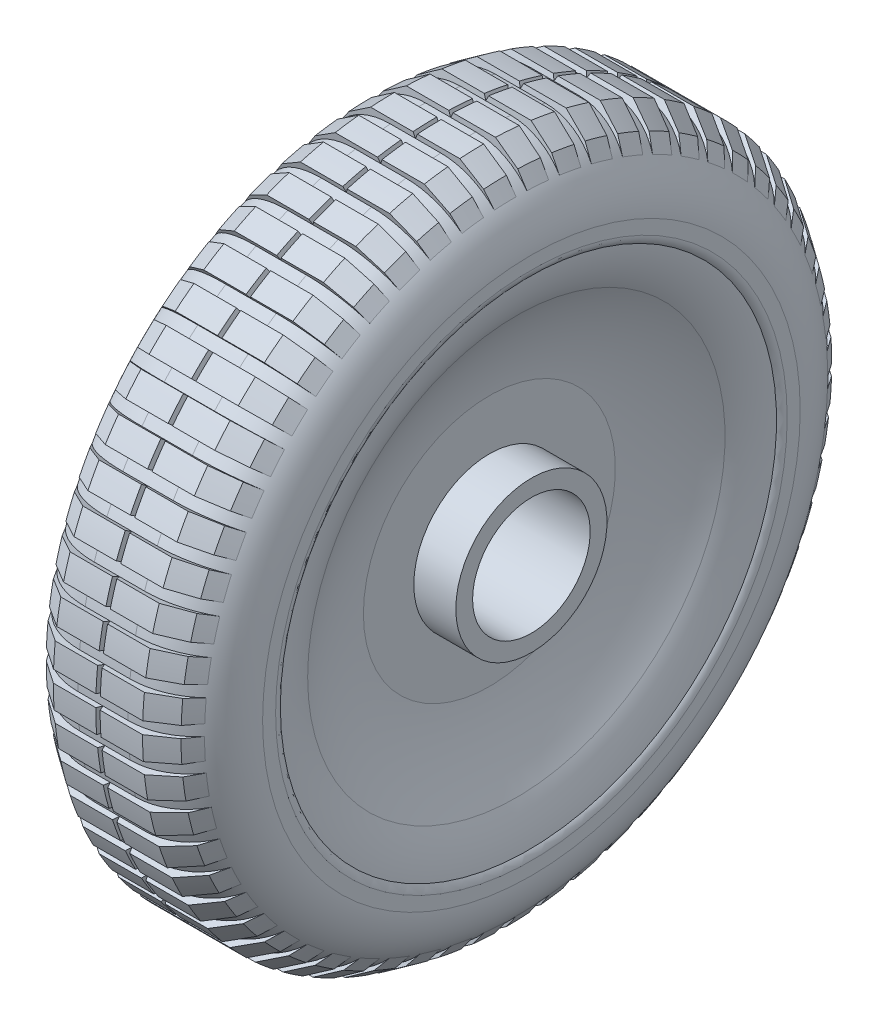
from build123d import *

# Parameters (mm, degrees)
REVOLVE4_ANGLE    = 4
CIRPATTERN3_COUNT = 60


with BuildPart() as part:
    # Sketch1 → Revolve1 (revolve)
    with BuildSketch(Plane(origin=(0, 0, 0), x_dir=(1, 0, 0), z_dir=(0, 1, 0)), mode=Mode.PRIVATE) as revolve1_sk:
        with BuildLine():
            ThreePointArc((23.020365128, 62.110796335), (17.79559805, 50.201216781), (15, 37.5))
            Line((15, 37.5), (15, 22.5))
            Line((15, 22.5), (27.5, 22.5))
            Line((27.5, 22.5), (27.5, 17.5))
            Line((27.5, 17.5), (22.5, 17.5))
            Line((22.5, 17.5), (10, 17.5))
            Line((10, 17.5), (0, 17.5))
            Line((0, 17.5), (0, 22.5))
            Line((0, 22.5), (10, 22.5))
            Line((10, 22.5), (10, 37.790602989))
            ThreePointArc((10, 37.790602989), (14.189944269, 55.004170467), (22.5, 70.650432387))
            Line((22.5, 70.650432387), (26.620041259, 73.837488135))
            ThreePointArc((26.620041259, 73.837488135), (25.44989925, 67.780848004), (23.020365128, 62.110796335))
        make_face()
    revolve(revolve1_sk.sketch.rotate(Axis((0, 0, 0), (1, 0, 0)), 180), axis=Axis((0, 0, 0), (1, 0, 0)))

    # Sketch2 → Revolve3 (revolve)
    with BuildSketch(Plane(origin=(0, 0, 0), x_dir=(1, 0, 0), z_dir=(0, 1, 0)), mode=Mode.PRIVATE) as revolve3_sk:
        with BuildLine():
            Line((22.5, 70.650432387), (26.620041259, 73.837488135))
            ThreePointArc((26.620041259, 73.837488135), (27.272425332, 74.899690518), (27.5, 76.125287781))
            Line((27.5, 76.125287781), (27.5, 80))
            ThreePointArc((27.5, 80), (21.642135624, 94.142135624), (7.5, 100))
            Line((7.5, 100), (0, 100))
            Line((0, 100), (0, 95))
            Line((0, 95), (7.5, 95))
            ThreePointArc((7.5, 95), (18.106601718, 90.606601718), (22.5, 80))
            Line((22.5, 80), (22.5, 70.650432387))
        make_face()
    revolve(revolve3_sk.sketch.rotate(Axis((-73.963678478, 0, 0), (1, 0, 0)), 180), axis=Axis((-73.963678478, 0, 0), (1, 0, 0)))

    # Sketch6 → Revolve4 (revolve)
    with BuildSketch(Plane.XY):
        Polygon((0.647826932, 101.495225565), (13.267498678, 101.495225565), (20.051454542, 96.825749451), (22.942557071, 92.709344244), (0, 100), align=None)
    revolve4 = revolve(axis=Axis((-86.412269374, 0, 0), (1, 0, 0)), revolution_arc=REVOLVE4_ANGLE)

    # CirPattern3: Revolve4 ×60 about axis
    cirpattern3_axis = Axis((0, 0, 0), (1, 0, 0))
    for i in range(1, CIRPATTERN3_COUNT):
        add(revolve4.rotate(cirpattern3_axis, i * 360 / CIRPATTERN3_COUNT))

    # Mirror2: read off the stored shape, not the designer's step
    # Mirror2: part across plane


with BuildPart() as part_1:
    add(part.part)
    add(part.part.mirror(Plane(origin=(0, 0, 0), x_dir=(0, 0, 1), z_dir=(1, 0, 0))))


solid = part_1.part
